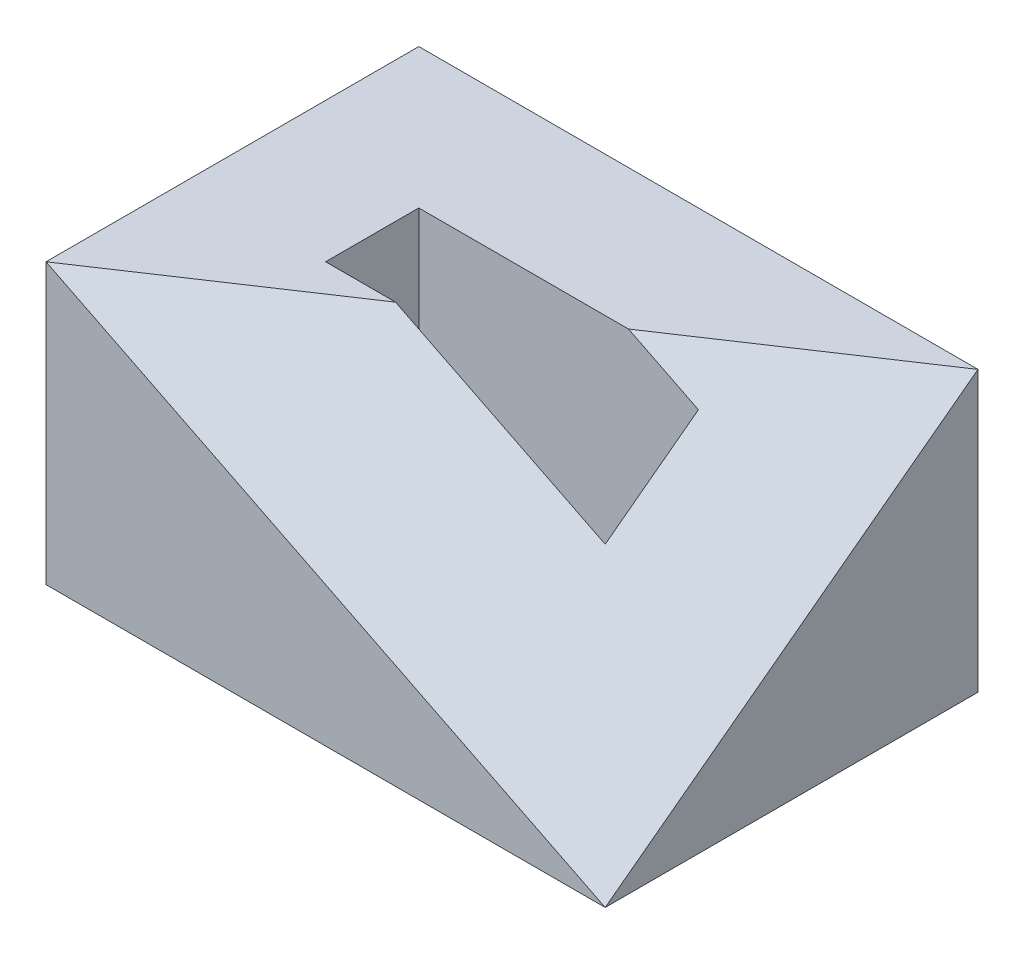
from build123d import *

# Parameters (mm, degrees)
SKETCH1_W           = 60
SKETCH1_H           = 40
BOSS_EXTRUDE1_DEPTH = 30
CUT_LOFT2_START     = -14
CUT_LOFT2_DEPTH     = 69
SKETCH9_W           = 30
SKETCH9_H           = 10
CUT_EXTRUDE4_DEPTH  = 50


with BuildPart() as part:
    # Sketch1 → Boss-Extrude1 (new body)
    with BuildSketch(Plane(origin=(0, 0, 0), x_dir=(1, 0, 0), z_dir=(0, 1, 0))):
        with Locations((30, 20)):
            Rectangle(SKETCH1_W, SKETCH1_H)
    extrude(amount=BOSS_EXTRUDE1_DEPTH)

    # Cut-Loft2: read off the stored shape, not the designer's step
    # Cut-Loft2 outline → Cut-Loft2 (cut)
    with BuildSketch(Plane(origin=(0, 0, 0), x_dir=(0.4472135954999584, 0.8944271909999156, 0), z_dir=(0.8944271909999156, -0.4472135954999584, 0)).offset(CUT_LOFT2_START)):
        Polygon((55, 0), (26.83281573, 0), (53.66563146, -40), (54.336451853, -41), (55, -41), align=None)
    extrude(amount=CUT_LOFT2_DEPTH, mode=Mode.SUBTRACT)

    # Sketch9 → Cut-Extrude4 (cut)
    with BuildSketch(Plane(origin=(0, 30, 0), x_dir=(1, 0, 0), z_dir=(0, 1, 0))):
        with Locations((30, 20)):
            Rectangle(SKETCH9_W, SKETCH9_H)
    extrude(amount=-CUT_EXTRUDE4_DEPTH, mode=Mode.SUBTRACT)


solid = part.part
